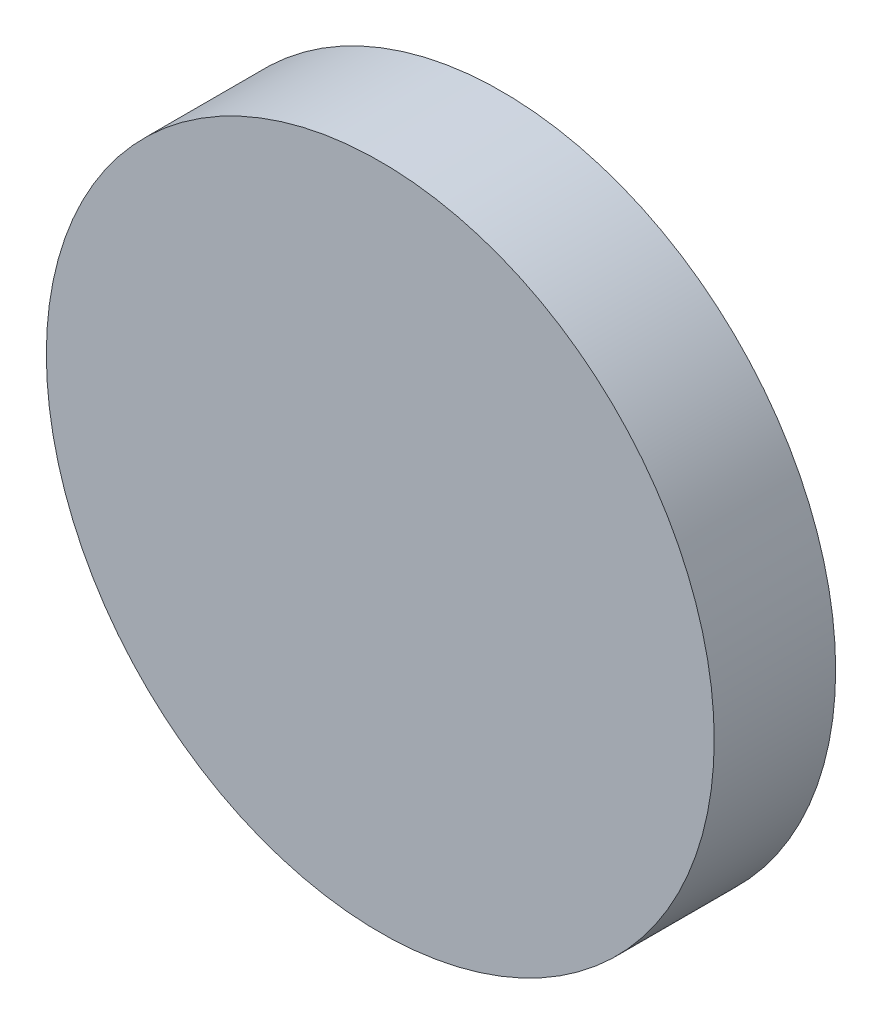
from build123d import *

# Parameters (mm, degrees)
SKETCH1_R           = 27.5
BOSS_EXTRUDE1_DEPTH = 10


with BuildPart() as part:
    # Sketch1 → Boss-Extrude1 (new body)
    with BuildSketch(Plane.XY):
        Circle(SKETCH1_R)
    extrude(amount=BOSS_EXTRUDE1_DEPTH)


solid = part.part
